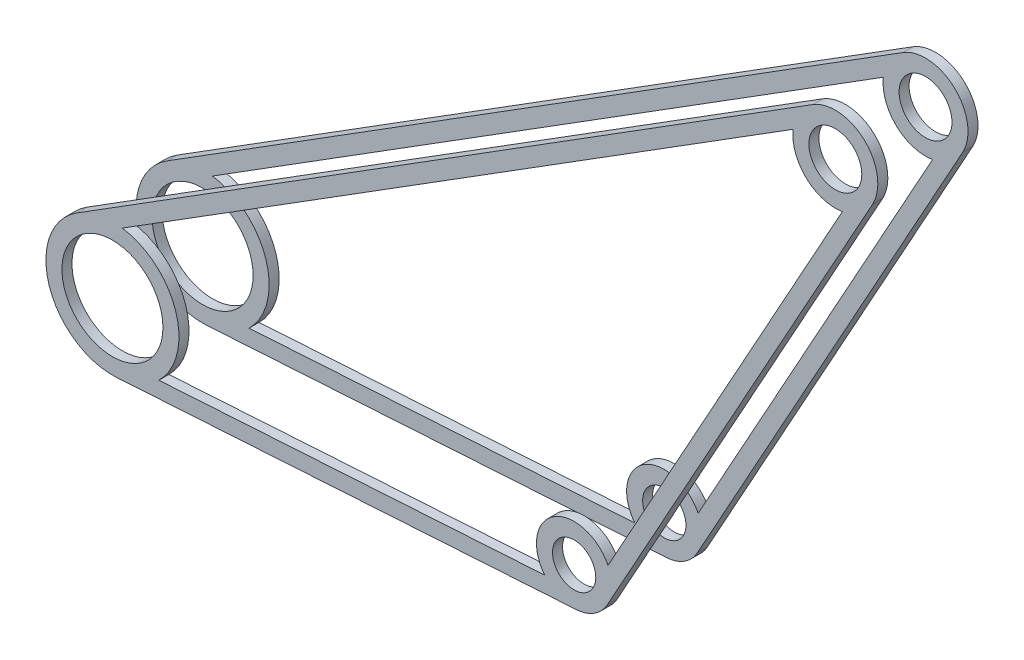
from build123d import *

# Parameters (mm, degrees)
BOSS_EXTRUDE1_START = 6.35
SKETCH1_R           = 8.001
SKETCH1_R_2         = 4.191
SKETCH1_R_3         = 3.429
BOSS_EXTRUDE1_DEPTH = 1.5875
BOSS_EXTRUDE2_START = -6.35
SKETCH1_4_R         = 8.001
SKETCH1_4_R_2       = 4.191
SKETCH1_4_R_3       = 3.429
BOSS_EXTRUDE2_DEPTH = 1.5875


with BuildPart() as part:
    # Sketch1 → Boss-Extrude1 (new body)
    with BuildSketch(Plane.XY.offset(BOSS_EXTRUDE1_START)):
        with BuildLine():
            ThreePointArc((-5.602921506, 8.928603004), (-10.033788157, -3.230445203), (0.6588125, -10.520391965))
            Line((0.6588125, -10.520391965), (73.5250625, -5.95733039))
            ThreePointArc((73.5250625, -5.95733039), (76.342746527, -5.044610748), (78.374819484, -2.889830036))
            Line((78.374819484, -2.889830036), (120.429451286, 73.115937667))
            ThreePointArc((120.429451286, 73.115937667), (119.166673021, 81.263366006), (110.962119735, 82.076079274))
            Line((110.962119735, 82.076079274), (-5.602921506, 8.928603004))
        make_face()
        Circle(SKETCH1_R, mode=Mode.SUBTRACT)
        with BuildLine():
            Line((1.560133531, 10.424905964), (107.850836903, 77.124978473))
            ThreePointArc((107.850836903, 77.124978473), (109.913104757, 71.485998344), (115.656983801, 69.737027472))
            Line((115.656983801, 69.737027472), (78.517746964, 2.61490354))
            ThreePointArc((78.517746964, 2.61490354), (69.961253473, 5.044610748), (68.490076839, -3.727657903))
            Line((68.490076839, -3.727657903), (7.349347762, -7.556438876))
            ThreePointArc((7.349347762, -7.556438876), (10.033788157, 3.230445203), (1.560133531, 10.424905964))
        make_face(mode=Mode.SUBTRACT)
        with Locations((114.539888889, 76.374682175)):
            Circle(SKETCH1_R_2, mode=Mode.SUBTRACT)
        with Locations((73.152, 0)):
            Circle(SKETCH1_R_3, mode=Mode.SUBTRACT)
    extrude(amount=BOSS_EXTRUDE1_DEPTH)


with BuildPart() as body_2:
    # Sketch1<4> → Boss-Extrude2 (new body)
    with BuildSketch(Plane.XY.offset(BOSS_EXTRUDE2_START)):
        with BuildLine():
            ThreePointArc((-5.602921506, 8.928603004), (-10.033788157, -3.230445203), (0.6588125, -10.520391965))
            Line((0.6588125, -10.520391965), (73.5250625, -5.95733039))
            ThreePointArc((73.5250625, -5.95733039), (76.342746527, -5.044610748), (78.374819484, -2.889830036))
            Line((78.374819484, -2.889830036), (120.429451286, 73.115937667))
            ThreePointArc((120.429451286, 73.115937667), (119.166673021, 81.263366006), (110.962119735, 82.076079274))
            Line((110.962119735, 82.076079274), (-5.602921506, 8.928603004))
        make_face()
        Circle(SKETCH1_4_R, mode=Mode.SUBTRACT)
        with BuildLine():
            Line((1.560133531, 10.424905964), (107.850836903, 77.124978473))
            ThreePointArc((107.850836903, 77.124978473), (109.913104757, 71.485998344), (115.656983801, 69.737027472))
            Line((115.656983801, 69.737027472), (78.517746964, 2.61490354))
            ThreePointArc((78.517746964, 2.61490354), (69.961253473, 5.044610748), (68.490076839, -3.727657903))
            Line((68.490076839, -3.727657903), (7.349347762, -7.556438876))
            ThreePointArc((7.349347762, -7.556438876), (10.033788157, 3.230445203), (1.560133531, 10.424905964))
        make_face(mode=Mode.SUBTRACT)
        with Locations((114.539888889, 76.374682175)):
            Circle(SKETCH1_4_R_2, mode=Mode.SUBTRACT)
        with Locations((73.152, 0)):
            Circle(SKETCH1_4_R_3, mode=Mode.SUBTRACT)
    extrude(amount=-BOSS_EXTRUDE2_DEPTH)


solid = Compound([part.part, body_2.part])
